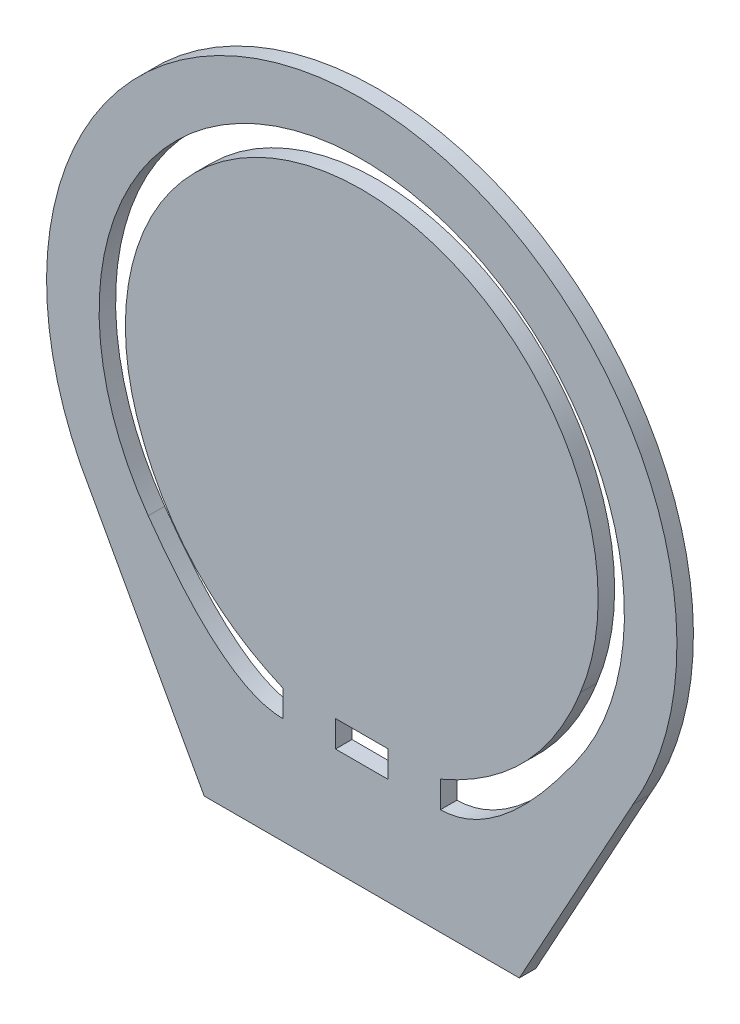
from build123d import *

# Parameters (mm, degrees)
ESBO_O1_R           = 30
ESBO_O1_R_2         = 25
BOSS_EXTRUDE1_DEPTH = 1.57
BOSS_EXTRUDE2_START = -1.57
BOSS_EXTRUDE2_DEPTH = 1.57
BOSS_EXTRUDE3_DEPTH = 1.57
BOSS_EXTRUDE4_START = -1.57
SKETCH4_R           = 22.5
BOSS_EXTRUDE4_DEPTH = 1.57
BOSS_EXTRUDE5_START = -1.57
BOSS_EXTRUDE5_DEPTH = 1.57
CUT_EXTRUDE1_START  = -1.57
CUT_EXTRUDE1_DEPTH  = 1.57
CUT_EXTRUDE2_START  = -10
CUT_EXTRUDE2_DEPTH  = 10
EXTRUDE_THIN2_START = -1.57
EXTRUDE_THIN2_DEPTH = 1.57
BOSS_EXTRUDE9_DEPTH = 1.57


# Read off the part's stored shape, not the designer's step: Extrude-Thin2
with BuildPart() as part:
    # Esboço1 → Boss-Extrude1 (new body)
    with BuildSketch(Plane.XY):
        Circle(ESBO_O1_R)
        Circle(ESBO_O1_R_2, mode=Mode.SUBTRACT)
    extrude(amount=BOSS_EXTRUDE1_DEPTH)

    # Sketch1 → Boss-Extrude2 (add)
    with BuildSketch(Plane.XY.offset(1.57).offset(BOSS_EXTRUDE2_START)):
        with BuildLine():
            Line((-25.800536663, -15.307916512), (-15, -35))
            Line((-15, -35), (-15, -25.980762114))
            ThreePointArc((-15, -25.980762114), (-21.086686707, -21.338970071), (-25.800536663, -15.307916512))
        make_face()
        with BuildLine():
            Line((-15, -35), (0, -35))
            Line((0, -35), (0, -30))
            ThreePointArc((0, -30), (-7.764571353, -28.977774789), (-15, -25.980762114))
            Line((-15, -25.980762114), (-15, -35))
        make_face()
        with BuildLine():
            Line((0, -35), (15, -35))
            Line((15, -35), (15, -25.980762114))
            ThreePointArc((15, -25.980762114), (7.764571353, -28.977774789), (0, -30))
            Line((0, -30), (0, -35))
        make_face()
        with BuildLine():
            Line((15, -25.980762114), (15, -35))
            Line((15, -35), (25.800536663, -15.307916512))
            ThreePointArc((25.800536663, -15.307916512), (21.086686707, -21.338970071), (15, -25.980762114))
        make_face()
    extrude(amount=BOSS_EXTRUDE2_DEPTH)

    # Sketch2 → Boss-Extrude3 (add)
    with BuildSketch(Plane.XY):
        with BuildLine():
            Line((-2.5, -25), (-2.5, -22.360679775))
            ThreePointArc((-2.5, -22.360679775), (-5.0328099, -21.929907079), (-7.5, -21.213203436))
            Line((-7.5, -21.213203436), (-7.5, -25))
            Line((-7.5, -25), (-2.5, -25))
        make_face()
        with BuildLine():
            ThreePointArc((7.5, -21.213203436), (5.0328099, -21.929907079), (2.5, -22.360679775))
            Line((2.5, -22.360679775), (2.5, -25))
            Line((2.5, -25), (7.5, -25))
            Line((7.5, -25), (7.5, -21.213203436))
        make_face()
    extrude(amount=BOSS_EXTRUDE3_DEPTH)

    # Sketch4 → Boss-Extrude4 (add)
    with BuildSketch(Plane.XY.offset(1.57).offset(BOSS_EXTRUDE4_START)):
        Circle(SKETCH4_R)
    extrude(amount=BOSS_EXTRUDE4_DEPTH)

    # Sketch5 → Boss-Extrude5 (add)
    with BuildSketch(Plane.XY.offset(1.57).offset(BOSS_EXTRUDE5_START)):
        with BuildLine():
            Line((2.5, -24.874685928), (-2.5, -24.874685928))
            ThreePointArc((-2.5, -24.874685928), (0, -25), (2.5, -24.874685928))
        make_face()
    extrude(amount=BOSS_EXTRUDE5_DEPTH)

    # Sketch6 → Cut-Extrude1 (cut)
    with BuildSketch(Plane.XY.offset(1.57).offset(CUT_EXTRUDE1_START)):
        with BuildLine():
            Line((-2.5, -22.360679775), (2.5, -22.360679775))
            ThreePointArc((2.5, -22.360679775), (0, -22.5), (-2.5, -22.360679775))
        make_face()
    extrude(amount=CUT_EXTRUDE1_DEPTH, mode=Mode.SUBTRACT)

    # Sketch7 → Cut-Extrude2 (cut)
    with BuildSketch(Plane.XY.offset(1.57).offset(CUT_EXTRUDE2_START)):
        with BuildLine():
            add(Edge.make_bspline(
                [(-20.323456945, -14.558746437), (-13.043190103, -24.874685928), (-7.5, -24.874685928)],
                knots=[0, 0, 0, 1, 1, 1], degree=2))
            Line((-7.5, -24.874685928), (-7.5, -23.848480035))
            ThreePointArc((-7.5, -23.848480035), (-14.666662084, -20.245716172), (-20.323456945, -14.558746437))
        make_face()
        with BuildLine():
            add(Edge.make_bspline(
                [(20.323456945, -14.558746437), (13.043190103, -24.874685928), (7.5, -24.874685928)],
                knots=[0, 0, 0, 1, 1, 1], degree=2))
            ThreePointArc((20.323456945, -14.558746437), (14.666662084, -20.245716172), (7.5, -23.848480035))
            Line((7.5, -23.848480035), (7.5, -24.874685928))
        make_face()
    extrude(amount=CUT_EXTRUDE2_DEPTH, mode=Mode.SUBTRACT)

    # Extrude-Thin2 outline → Extrude-Thin2 (add)
    with BuildSketch(Plane.XY.offset(1.57).offset(EXTRUDE_THIN2_START)):
        with BuildLine():
            add(Edge.make_bspline(
                [(-7.5, -22.360679775), (-16.957974034, -18.314631092), (-20.809324876, -8.556985344)],
                knots=[0, 0, 0, 0.902799725, 0.902799725, 0.902799725], degree=2))
            Line((-7.5, -22.360679775), (-7.5, -21.213203436))
            ThreePointArc((-7.5, -21.213203436), (-15.504819665, -16.30492463), (-20.809324876, -8.556985344))
        make_face()
    extrude(amount=EXTRUDE_THIN2_DEPTH)

    # Sketch10 → Boss-Extrude9 (add)
    with BuildSketch(Plane.XY.offset(1.57)):
        with BuildLine():
            Line((2.499590074, -22.36028679), (2.499590074, -20.208780459))
            Line((2.499590074, -20.208780459), (21.573238209, -6.389263197))
            add(Edge.make_bspline(
                [(7.499590074, -22.36028679), (17.975860478, -17.878618737), (21.573238209, -6.389263197)],
                knots=[0, 0, 0, 1, 1, 1], degree=2))
            Line((7.499590074, -22.36028679), (2.499590074, -22.36028679))
        make_face()
    extrude(amount=-BOSS_EXTRUDE9_DEPTH)


solid = part.part
